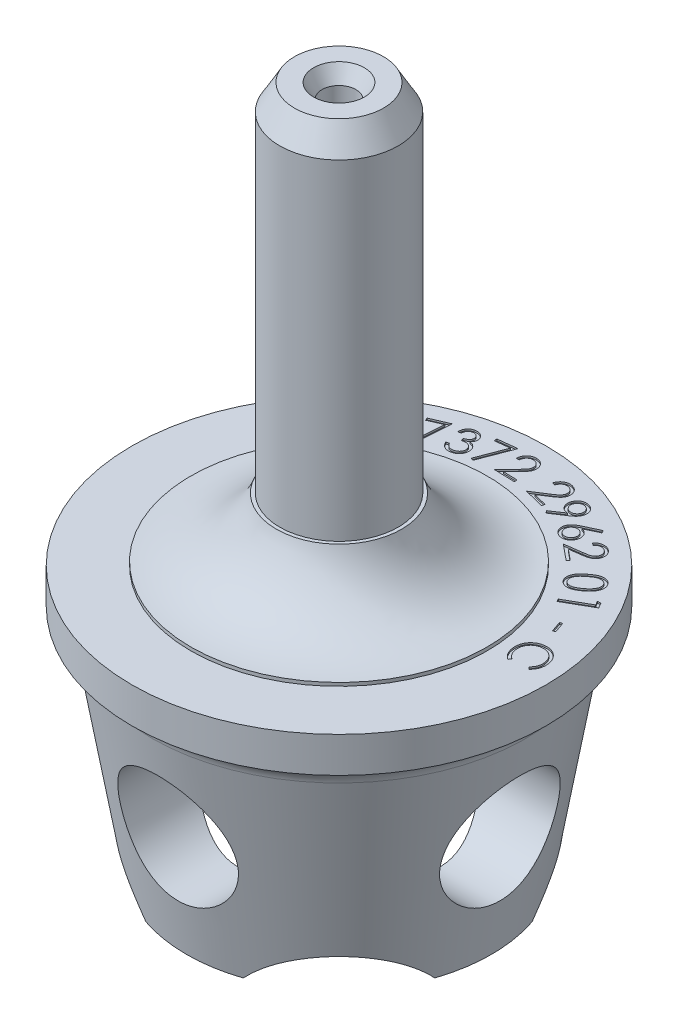
from build123d import *

# Parameters (mm, degrees)
SKETCH2_R          = 3.5
CUT_EXTRUDE1_DEPTH = 44.668194948
CIRPATTERN1_COUNT  = 4
SKETCH3_R          = 5
CUT_EXTRUDE2_DEPTH = 44.668194948
CIRPATTERN2_COUNT  = 4
WRAP3_START        = -0.1
WRAP3_DEPTH        = 0.1


# Read off the part's stored shape, not the designer's step: Wrap3
with BuildPart() as part:
    # Sketch1 → Revolve1 (revolve)
    with BuildSketch(Plane(origin=(0, 0, 0), x_dir=(0, 0, -1), z_dir=(1, 0, 0)), mode=Mode.PRIVATE) as revolve1_sk:
        with BuildLine():
            Line((1.5, 40.1), (2.631474596, 40.1))
            Line((2.631474596, 40.1), (3.4975, 38.6))
            Line((3.4975, 38.6), (3.4975, 19.1))
            Line((3.4975, 19.1), (3.7, 19.1))
            ThreePointArc((3.7, 19.1), (5.659509989, 16.534078699), (8.75, 15.6))
            Line((8.75, 15.6), (8.75, 15.4))
            Line((8.75, 15.4), (12.225, 15.4))
            Line((12.225, 15.4), (12.225, 13.3))
            ThreePointArc((12.225, 13.3), (11.449328772, 12.872543712), (11.05, 12.082024096))
            Line((11.05, 12.082024096), (9, 0))
            Line((9, 0), (7, 0))
            Line((7, 0), (6, 3))
            Line((6, 3), (6, 9.2))
            ThreePointArc((6, 9.2), (5.765685425, 9.765685425), (5.2, 10))
            Line((5.2, 10), (1.5, 10))
            Line((1.5, 10), (1, 10.866025404))
            Line((1, 10.866025404), (1, 13.265164785))
            Line((1, 13.265164785), (0, 13.866025404))
            Line((0, 13.866025404), (0, 36.233974596))
            Line((0, 36.233974596), (1, 36.834835215))
            Line((1, 36.834835215), (1, 39.233974596))
            Line((1, 39.233974596), (1.5, 40.1))
        make_face()
    revolve(revolve1_sk.sketch.rotate(Axis((0, 52.857058389, 0), (0, -1, 0)), 180), axis=Axis((0, 52.857058389, 0), (0, -1, 0)))

    # Sketch2 → Cut-Extrude1 (cut, symmetric)
    with BuildSketch(Plane.XY):
        with Locations(Location((0, 6.5, 0), (0, 0, 50.482347203))):
            Circle(SKETCH2_R)
    cut_extrude1 = extrude(amount=CUT_EXTRUDE1_DEPTH, both=True, mode=Mode.SUBTRACT)

    # CirPattern1: Cut-Extrude1 ×4 about axis
    cirpattern1_axis = Axis((0, 42, 0), (0, -1, 0))
    for i in range(1, CIRPATTERN1_COUNT):
        add(cut_extrude1.rotate(cirpattern1_axis, i * 360 / CIRPATTERN1_COUNT), mode=Mode.SUBTRACT)

    # Sketch3 → Cut-Extrude2 (cut, symmetric)
    with BuildSketch(Plane(origin=(0, 0, 0), x_dir=(0.7071067811865462, 0, 0.7071067811865488), z_dir=(-0.7071067811865488, 0, 0.7071067811865462))):
        with Locations((0, -3)):
            Circle(SKETCH3_R)
    cut_extrude2 = extrude(amount=CUT_EXTRUDE2_DEPTH, both=True, mode=Mode.SUBTRACT)

    # CirPattern2: Cut-Extrude2 ×4 about axis
    cirpattern2_axis = Axis((0, 42, 0), (0, -1, 0))
    for i in range(1, CIRPATTERN2_COUNT):
        add(cut_extrude2.rotate(cirpattern2_axis, i * 360 / CIRPATTERN2_COUNT), mode=Mode.SUBTRACT)

    # Wrap3 outline → Wrap3 (cut)
    # profile 1 of 12: a face of its own
    with BuildSketch(Plane(origin=(0, 15.4, 0), x_dir=(1, 0, 0), z_dir=(0, 1, 0)).offset(WRAP3_START)):
        with BuildLine():
            add(Edge.make_bspline(
                [(-3.326584823, 10.336542313), (-3.326981677, 10.355056697), (-3.327758048, 10.39127662), (-3.324233451, 10.444385593), (-3.318102106, 10.495213365), (-3.307373218, 10.543590824), (-3.2938904, 10.58988524), (-3.276508423, 10.633703424), (-3.255485631, 10.675103162), (-3.230849036, 10.713891087), (-3.203767968, 10.750441524), (-3.17310322, 10.783192329), (-3.140567497, 10.81335966), (-3.105630271, 10.840542234), (-3.067845607, 10.864052059), (-3.027561277, 10.884179382), (-2.984985768, 10.901779348), (-2.95516291, 10.910491633), (-2.940046361, 10.914907698)],
                knots=[0, 0, 0, 0, 0.073357808, 0.143510807, 0.21074725, 0.276054401, 0.339655963, 0.401662468, 0.462589232, 0.523381781, 0.583591151, 0.642582275, 0.700900299, 0.759305798, 0.817724893, 0.876946347, 0.937626821, 1, 1, 1, 1], degree=3))
            Line((-3.326584823, 10.336542313), (-3.150623284, 10.38377789))
            add(Edge.make_bspline(
                [(-2.894974246, 10.747239429), (-2.912758008, 10.741695829), (-2.94752024, 10.730859657), (-2.994854382, 10.704940465), (-3.036820602, 10.673027788), (-3.066158303, 10.640171488), (-3.086349237, 10.610418488), (-3.099920619, 10.585468062), (-3.112359128, 10.558165108), (-3.122991733, 10.528203898), (-3.132496859, 10.495741491), (-3.139729662, 10.460585427), (-3.146534293, 10.423132568), (-3.149234555, 10.397143778), (-3.150623284, 10.38377789)],
                knots=[0, 0, 0, 0, 0.116632374, 0.227983345, 0.336593426, 0.446071954, 0.502548713, 0.56195558, 0.624058588, 0.690617562, 0.761267871, 0.836116505, 0.915715642, 1, 1, 1, 1], degree=3))
            add(Edge.make_bspline(
                [(-2.504469438, 10.555412506), (-2.507308883, 10.564603396), (-2.512897852, 10.582694114), (-2.524065216, 10.608619011), (-2.538326109, 10.632357211), (-2.554669646, 10.654755372), (-2.573853456, 10.675255808), (-2.595620058, 10.694086599), (-2.619923579, 10.711090534), (-2.646449822, 10.72598662), (-2.674428976, 10.739087876), (-2.7036976, 10.749140003), (-2.73375839, 10.756370655), (-2.764539013, 10.760822889), (-2.796078506, 10.761762807), (-2.828397026, 10.759891324), (-2.861592985, 10.75528611), (-2.883714543, 10.749953623), (-2.894974246, 10.747239429)],
                knots=[0, 0, 0, 0, 0.059601419, 0.117315354, 0.17442514, 0.230894843, 0.288877394, 0.348025493, 0.408993958, 0.472381217, 0.536378401, 0.600223651, 0.663825049, 0.727774522, 0.792624523, 0.859030469, 0.928247594, 1, 1, 1, 1], degree=3))
            add(Edge.make_bspline(
                [(-2.828267515, 10.159859621), (-2.809145828, 10.165488607), (-2.771464578, 10.176581101), (-2.718120283, 10.199491967), (-2.668690256, 10.226626634), (-2.623976193, 10.257703071), (-2.584792831, 10.291578748), (-2.552475021, 10.327246828), (-2.52724247, 10.363955228), (-2.510124851, 10.402061864), (-2.499690832, 10.440569181), (-2.494796339, 10.479059003), (-2.496142049, 10.517700151), (-2.501669466, 10.542732236), (-2.504469438, 10.555412506)],
                knots=[0, 0, 0, 0, 0.105059787, 0.207031101, 0.305489388, 0.402037203, 0.493699365, 0.578093251, 0.655281639, 0.727632464, 0.797300594, 0.865002714, 0.931615689, 1, 1, 1, 1], degree=3))
            Line((-2.828267515, 10.159859621), (-2.785719438, 10.001566352))
            add(Edge.make_bspline(
                [(-2.179950207, 9.760700967), (-2.185116258, 9.777115303), (-2.195374002, 9.809707715), (-2.219357431, 9.85530692), (-2.250104571, 9.897092713), (-2.286698217, 9.935078565), (-2.328187516, 9.968121199), (-2.373791374, 9.994845764), (-2.423020047, 10.014503504), (-2.466952387, 10.024836714), (-2.504584203, 10.030220212), (-2.53606269, 10.031911225), (-2.570353221, 10.031247142), (-2.60766663, 10.029621229), (-2.6479703, 10.025537257), (-2.691227348, 10.019264623), (-2.737518615, 10.011324355), (-2.769269292, 10.004896597), (-2.785719438, 10.001566352)],
                knots=[0, 0, 0, 0, 0.070451916, 0.139889784, 0.210077449, 0.282578574, 0.355547238, 0.426889945, 0.498550288, 0.572066162, 0.611377059, 0.654325896, 0.701149386, 0.751972872, 0.807437833, 0.867170545, 0.931180558, 1, 1, 1, 1], degree=3))
            add(Edge.make_bspline(
                [(-2.494012707, 9.273561544), (-2.478903847, 9.277997226), (-2.449246375, 9.28670411), (-2.407197179, 9.303739179), (-2.368077638, 9.323252039), (-2.332384788, 9.345907606), (-2.300012793, 9.371693043), (-2.27103992, 9.400464033), (-2.244846488, 9.431757204), (-2.222748777, 9.466165955), (-2.203820667, 9.501758928), (-2.188473086, 9.538042816), (-2.177167215, 9.57464054), (-2.170059957, 9.611528243), (-2.166254978, 9.648592087), (-2.166737837, 9.685935082), (-2.170885429, 9.723570374), (-2.176911278, 9.748253091), (-2.179950207, 9.760700967)],
                knots=[0, 0, 0, 0, 0.072956248, 0.143207219, 0.209985295, 0.275365767, 0.338799036, 0.401441928, 0.464361718, 0.527567017, 0.590624799, 0.651055634, 0.709919949, 0.76783259, 0.824935526, 0.882325863, 0.940655109, 1, 1, 1, 1], degree=3))
            add(Edge.make_bspline(
                [(-2.791488669, 9.295556736), (-2.780400592, 9.290410918), (-2.758272846, 9.280141745), (-2.723471712, 9.268643687), (-2.687597186, 9.260624358), (-2.650739041, 9.256467102), (-2.612846267, 9.255241988), (-2.574026007, 9.258011361), (-2.5340499, 9.263590058), (-2.507544973, 9.270191258), (-2.494012707, 9.273561544)],
                knots=[0, 0, 0, 0, 0.120091283, 0.239658275, 0.359487699, 0.480839544, 0.603774468, 0.731652338, 0.862993325, 1, 1, 1, 1], degree=3))
            add(Edge.make_bspline(
                [(-2.984036746, 9.503970198), (-2.976585167, 9.491394614), (-2.962198892, 9.467115759), (-2.939239513, 9.432921116), (-2.916102585, 9.401805802), (-2.891657437, 9.374518064), (-2.86765085, 9.349751462), (-2.843008091, 9.328300961), (-2.817824827, 9.310070893), (-2.800125683, 9.300316693), (-2.791488669, 9.295556736)],
                knots=[0, 0, 0, 0, 0.152493168, 0.294408564, 0.429603827, 0.556666854, 0.676387874, 0.789293669, 0.897177306, 1, 1, 1, 1], degree=3))
            Line((-2.984036746, 9.503970198), (-3.152786746, 9.458898083))
            add(Edge.make_bspline(
                [(-2.45146463, 9.105172121), (-2.469791002, 9.100659681), (-2.505703834, 9.091816987), (-2.559768406, 9.08396565), (-2.612481633, 9.080557875), (-2.664113855, 9.082135904), (-2.714485097, 9.087676309), (-2.763623404, 9.098285715), (-2.811425409, 9.113521071), (-2.857968967, 9.133323316), (-2.902812017, 9.157910543), (-2.945411743, 9.187195103), (-2.985709992, 9.221144973), (-3.02403085, 9.259336013), (-3.059758715, 9.302599218), (-3.09329949, 9.350384816), (-3.124732882, 9.402701845), (-3.14330003, 9.43989472), (-3.152786746, 9.458898083)],
                knots=[0, 0, 0, 0, 0.065534887, 0.128423856, 0.189501395, 0.24881655, 0.30765361, 0.365308332, 0.423147221, 0.481702102, 0.540752126, 0.600513844, 0.660978877, 0.723571904, 0.788206735, 0.855628573, 0.926234724, 1, 1, 1, 1], degree=3))
            add(Edge.make_bspline(
                [(-2.013724246, 9.82019616), (-2.008206292, 9.795787552), (-1.997184639, 9.747033393), (-1.993391749, 9.671675422), (-1.99918433, 9.595586966), (-2.012516498, 9.532372676), (-2.02762743, 9.482518646), (-2.041376472, 9.446078744), (-2.057759483, 9.411330043), (-2.075567346, 9.377360002), (-2.096767393, 9.345560997), (-2.119393192, 9.314567751), (-2.144780593, 9.285449527), (-2.181284457, 9.248404262), (-2.231696355, 9.206524297), (-2.298757001, 9.163937894), (-2.372320843, 9.129304891), (-2.424789307, 9.113306044), (-2.45146463, 9.105172121)],
                knots=[0, 0, 0, 0, 0.080290528, 0.160373634, 0.241331161, 0.324956104, 0.367351386, 0.408668593, 0.449967745, 0.490748944, 0.531778121, 0.572641539, 0.613989423, 0.655775128, 0.739693884, 0.823909854, 0.910474571, 1, 1, 1, 1], degree=3))
            add(Edge.make_bspline(
                [(-2.208435784, 10.097119236), (-2.196385166, 10.088052404), (-2.172636116, 10.070183723), (-2.140016059, 10.040418543), (-2.110790009, 10.008618572), (-2.084580479, 9.974942079), (-2.061886307, 9.939141612), (-2.042279983, 9.901414975), (-2.025921826, 9.861716422), (-2.017808799, 9.834099878), (-2.013724246, 9.82019616)],
                knots=[0, 0, 0, 0, 0.130880761, 0.257936462, 0.382748186, 0.505483529, 0.627939064, 0.750225517, 0.874249502, 1, 1, 1, 1], degree=3))
            add(Edge.make_bspline(
                [(-2.451825207, 10.19050866), (-2.429452421, 10.187021725), (-2.38537444, 10.180151904), (-2.322222229, 10.15955921), (-2.262460756, 10.133028039), (-2.226407674, 10.10906462), (-2.208435784, 10.097119236)],
                knots=[0, 0, 0, 0, 0.257610632, 0.507534289, 0.754513658, 1, 1, 1, 1], degree=3))
            add(Edge.make_bspline(
                [(-2.32490213, 10.602287506), (-2.320620317, 10.583987984), (-2.312216849, 10.548073425), (-2.309283084, 10.493330868), (-2.313534612, 10.439817275), (-2.325515805, 10.387273156), (-2.345853855, 10.33599058), (-2.37343434, 10.285724233), (-2.408827883, 10.236459013), (-2.437157693, 10.20618353), (-2.451825207, 10.19050866)],
                knots=[0, 0, 0, 0, 0.124283765, 0.243918757, 0.361339877, 0.478955161, 0.599448008, 0.725571952, 0.857917249, 1, 1, 1, 1], degree=3))
            add(Edge.make_bspline(
                [(-2.940046361, 10.914907698), (-2.917673528, 10.920213195), (-2.873445501, 10.930701436), (-2.805732795, 10.935534123), (-2.738407195, 10.9333636), (-2.672201865, 10.922001787), (-2.608636574, 10.9034541), (-2.549099149, 10.877881525), (-2.495070232, 10.84440639), (-2.446738566, 10.804285552), (-2.404908069, 10.759129904), (-2.369661882, 10.710467769), (-2.342417522, 10.658070005), (-2.330740817, 10.620882381), (-2.32490213, 10.602287506)],
                knots=[0, 0, 0, 0, 0.090006377, 0.177930281, 0.265160858, 0.353544378, 0.44046773, 0.524239674, 0.60674991, 0.68873649, 0.769753327, 0.847422227, 0.923706748, 1, 1, 1, 1], degree=3))
        make_face()
    # profile 2 of 12: a face of its own
    with BuildSketch(Plane(origin=(0, 15.4, 0), x_dir=(1, 0, 0), z_dir=(0, 1, 0)).offset(WRAP3_START)):
        with BuildLine():
            add(Edge.make_bspline(
                [(8.891250508, 6.988660551), (8.899816109, 6.977109), (8.916746212, 6.954277103), (8.939314287, 6.918388866), (8.958431342, 6.881206012), (8.974274443, 6.842792272), (8.987379954, 6.803440105), (8.997185224, 6.76279621), (9.003496162, 6.72103944), (9.007174544, 6.678287592), (9.007736782, 6.634733661), (9.003789569, 6.590647723), (8.997153532, 6.545972035), (8.986031448, 6.501012123), (8.97203132, 6.455426578), (8.954251022, 6.409375916), (8.932442456, 6.363077368), (8.907528319, 6.315817389), (8.878289973, 6.268057647), (8.843750538, 6.220026238), (8.804299291, 6.171458943), (8.76021389, 6.121820868), (8.710788743, 6.071972301), (8.656490693, 6.021393785), (8.597339211, 5.970125301), (8.555435492, 5.936708717), (8.533918777, 5.919549974)],
                knots=[0, 0, 0, 0, 0.034096833, 0.067393149, 0.100411342, 0.133125464, 0.165845794, 0.198685099, 0.232145721, 0.265901284, 0.300392588, 0.335284381, 0.37076042, 0.407402501, 0.44499893, 0.483800305, 0.524353529, 0.566305141, 0.610449912, 0.657038428, 0.706496357, 0.758786678, 0.814417425, 0.872903227, 0.93473837, 1, 1, 1, 1], degree=3))
            add(Edge.make_bspline(
                [(7.779952431, 6.881208628), (7.802658385, 6.898811316), (7.846689607, 6.932946321), (7.912943284, 6.979775108), (7.976392263, 7.022037162), (8.037108703, 7.059791019), (8.095762851, 7.091842342), (8.151643195, 7.119585435), (8.205256311, 7.141962705), (8.256743845, 7.159504149), (8.306269132, 7.172897367), (8.354573859, 7.182730988), (8.401786034, 7.189216743), (8.447922526, 7.192645292), (8.492888175, 7.192209957), (8.536760203, 7.188620821), (8.579569133, 7.181821171), (8.621197071, 7.171756407), (8.661111308, 7.158291444), (8.699625049, 7.142428896), (8.736274116, 7.123726971), (8.771168205, 7.102337279), (8.804107384, 7.078097123), (8.835044045, 7.050915109), (8.864578373, 7.021354681), (8.882295537, 6.999637362), (8.891250508, 6.988660551)],
                knots=[0, 0, 0, 0, 0.068628769, 0.133084417, 0.193768777, 0.250747723, 0.303821968, 0.353390781, 0.399730702, 0.442499084, 0.483246612, 0.522215171, 0.560183888, 0.597028499, 0.632634968, 0.667497312, 0.702099719, 0.736085455, 0.769682016, 0.802636838, 0.835511502, 0.86786667, 0.900314717, 0.933080102, 0.966175978, 1, 1, 1, 1], degree=3))
            add(Edge.make_bspline(
                [(7.411442815, 5.828324013), (7.402979712, 5.839623471), (7.38619621, 5.862031855), (7.364205874, 5.897458384), (7.345333323, 5.933968428), (7.329842263, 5.971667617), (7.317186907, 6.010354789), (7.307401397, 6.049985253), (7.300846638, 6.09074508), (7.297707754, 6.132466665), (7.297570938, 6.175039409), (7.301411121, 6.218046895), (7.308030779, 6.261537182), (7.319207088, 6.305159902), (7.333156323, 6.349331622), (7.3510712, 6.393645484), (7.371913881, 6.438604851), (7.397042022, 6.483859827), (7.426522347, 6.530073773), (7.461097746, 6.577260368), (7.501555658, 6.625107029), (7.546443359, 6.674640041), (7.597341193, 6.724683751), (7.653169572, 6.776254115), (7.714482818, 6.828817616), (7.757732741, 6.863427677), (7.779952431, 6.881208628)],
                knots=[0, 0, 0, 0, 0.033748241, 0.066927417, 0.099579509, 0.131926553, 0.164285087, 0.19684089, 0.229446139, 0.262888214, 0.296804946, 0.331129665, 0.366050924, 0.401882959, 0.438697562, 0.476753546, 0.516101014, 0.557140131, 0.600436278, 0.647117766, 0.696910388, 0.750216051, 0.806921395, 0.867537091, 0.931947055, 1, 1, 1, 1], degree=3))
            add(Edge.make_bspline(
                [(8.533918777, 5.919549974), (8.512276911, 5.902813443), (8.470108944, 5.870203245), (8.406543149, 5.824999373), (8.344622073, 5.784735867), (8.284731319, 5.748758781), (8.226514163, 5.717797445), (8.170351377, 5.690658945), (8.115462786, 5.669276615), (8.062595476, 5.651555781), (8.011026334, 5.638717815), (7.960964165, 5.62892592), (7.912215339, 5.622230743), (7.864611302, 5.619431071), (7.818206803, 5.619593607), (7.773008852, 5.623651222), (7.729131533, 5.630864908), (7.686557938, 5.641298662), (7.645551649, 5.65492361), (7.606489236, 5.671697197), (7.569113993, 5.690744251), (7.533791563, 5.712888437), (7.500047977, 5.737445384), (7.46826546, 5.764874706), (7.438605292, 5.795276241), (7.420543224, 5.817251818), (7.411442815, 5.828324013)],
                knots=[0, 0, 0, 0, 0.064930891, 0.126514217, 0.185067459, 0.240205524, 0.29227683, 0.34153305, 0.388151054, 0.43199458, 0.473785351, 0.514179895, 0.553033004, 0.590473806, 0.62727554, 0.663072871, 0.698059643, 0.732723928, 0.767004584, 0.800492655, 0.833537934, 0.866468495, 0.899334738, 0.93250538, 0.965993451, 1, 1, 1, 1], degree=3))
        make_face()
        with BuildLine():
            add(Edge.make_bspline(
                [(7.542692815, 5.92351632), (7.555561842, 5.908734771), (7.581290173, 5.879182839), (7.62869393, 5.843224753), (7.682611089, 5.815412996), (7.731784138, 5.798263931), (7.773815198, 5.789204359), (7.806894046, 5.785367676), (7.84077074, 5.783795038), (7.87559522, 5.785461537), (7.91141197, 5.789307981), (7.948200111, 5.796422831), (7.986114247, 5.805558272), (8.01125751, 5.813952611), (8.024063008, 5.818227859)],
                knots=[0, 0, 0, 0, 0.111270375, 0.222456684, 0.33592389, 0.455286661, 0.517512646, 0.580187813, 0.644519489, 0.710217475, 0.778326361, 0.849269627, 0.92323282, 1, 1, 1, 1], degree=3))
            add(Edge.make_bspline(
                [(7.881274546, 6.745631705), (7.862065319, 6.730489043), (7.824774237, 6.701092428), (7.772323911, 6.656475032), (7.724649048, 6.613358378), (7.681070274, 6.572410904), (7.642506928, 6.532402164), (7.608617931, 6.49386774), (7.57911137, 6.457103725), (7.554356162, 6.421332115), (7.533194458, 6.386568622), (7.515593057, 6.35207292), (7.500204189, 6.318143828), (7.48786832, 6.284154341), (7.478589161, 6.25011228), (7.471456678, 6.2163202), (7.468065816, 6.182608116), (7.4665108, 6.13895738), (7.470974251, 6.086302987), (7.485453572, 6.026676967), (7.508717824, 5.971578959), (7.531389718, 5.939506219), (7.542692815, 5.92351632)],
                knots=[0, 0, 0, 0, 0.073813239, 0.143294445, 0.207759163, 0.267797027, 0.323720771, 0.375382526, 0.422627823, 0.465894504, 0.506578347, 0.545351289, 0.582696471, 0.618954807, 0.654331528, 0.689117548, 0.723045751, 0.756434508, 0.820867583, 0.881746563, 0.941044626, 1, 1, 1, 1], degree=3))
            add(Edge.make_bspline(
                [(8.761082238, 6.87868459), (8.748269187, 6.893656542), (8.722695218, 6.923539529), (8.674370199, 6.958885298), (8.620190589, 6.987525891), (8.570004706, 7.00356117), (8.527711034, 7.013403284), (8.49437582, 7.017668111), (8.46012553, 7.018995323), (8.425064809, 7.017888815), (8.389139037, 7.014298336), (8.352274278, 7.007726717), (8.314511756, 6.998251767), (8.275474628, 6.98621388), (8.234717523, 6.971086946), (8.191948957, 6.951100591), (8.146312243, 6.927557484), (8.098387831, 6.898985496), (8.047497873, 6.867163215), (7.994432594, 6.830242615), (7.938338841, 6.789863166), (7.900656465, 6.760654945), (7.881274546, 6.745631705)],
                knots=[0, 0, 0, 0, 0.059241393, 0.118241747, 0.179192209, 0.243370321, 0.276429089, 0.31005314, 0.344512495, 0.379682971, 0.415744027, 0.453280917, 0.492483113, 0.533063207, 0.576413134, 0.62344259, 0.675312667, 0.731190673, 0.791618493, 0.856255426, 0.926065022, 1, 1, 1, 1], degree=3))
            add(Edge.make_bspline(
                [(8.427188008, 6.049357667), (8.444487164, 6.063044533), (8.478228417, 6.089740171), (8.52584645, 6.131157563), (8.570296754, 6.171713843), (8.610951684, 6.212125919), (8.648331499, 6.251752613), (8.681861214, 6.291227403), (8.712356117, 6.329916459), (8.738599218, 6.368698367), (8.761824103, 6.406720967), (8.782064762, 6.443919116), (8.79874075, 6.480737901), (8.812602887, 6.516674622), (8.822961461, 6.552172512), (8.830931725, 6.586910399), (8.834668943, 6.621139842), (8.836167369, 6.664930843), (8.831630242, 6.717296393), (8.817612783, 6.776580232), (8.794786628, 6.831269743), (8.772273954, 6.862940247), (8.761082238, 6.87868459)],
                knots=[0, 0, 0, 0, 0.06655196, 0.129806704, 0.190382626, 0.248083887, 0.302736698, 0.354701344, 0.404322447, 0.451299265, 0.495896071, 0.538734322, 0.578984329, 0.617781711, 0.654847028, 0.690486775, 0.725170769, 0.758554287, 0.822615883, 0.883047238, 0.941859326, 1, 1, 1, 1], degree=3))
            add(Edge.make_bspline(
                [(8.024063008, 5.818227859), (8.040232049, 5.824074955), (8.073011875, 5.835928891), (8.121842134, 5.857075377), (8.171299463, 5.881251305), (8.221322617, 5.908810704), (8.272246817, 5.938970268), (8.323476611, 5.972734466), (8.375488696, 6.00946061), (8.409734804, 6.035888794), (8.427188008, 6.049357667)],
                knots=[0, 0, 0, 0, 0.110475976, 0.223970198, 0.341769759, 0.464137909, 0.590912467, 0.72202727, 0.858333842, 1, 1, 1, 1], degree=3))
        make_face(mode=Mode.SUBTRACT)
    # profile 3 of 12: a face of its own
    with BuildSketch(Plane(origin=(0, 15.4, 0), x_dir=(1, 0, 0), z_dir=(0, 1, 0)).offset(WRAP3_START)):
        with BuildLine():
            add(Edge.make_bspline(
                [(6.338874923, 8.634579887), (6.353421738, 8.650435291), (6.382009477, 8.681594696), (6.428236261, 8.723628507), (6.476839112, 8.759866666), (6.527342635, 8.79073118), (6.58014709, 8.815652321), (6.634706206, 8.835790083), (6.691585593, 8.849712808), (6.74977869, 8.858278366), (6.808205729, 8.861634578), (6.865834482, 8.859138905), (6.922046948, 8.850865552), (6.976715527, 8.836612566), (7.030071026, 8.817126912), (7.081829171, 8.791628722), (7.132199541, 8.760589681), (7.163730477, 8.736084759), (7.179740307, 8.723642387)],
                knots=[0, 0, 0, 0, 0.06850539, 0.134628377, 0.198629938, 0.261323496, 0.322790925, 0.384306009, 0.446229427, 0.508917142, 0.571405866, 0.632327375, 0.692308441, 0.752005467, 0.811951101, 0.872895454, 0.93546268, 1, 1, 1, 1], degree=3))
            Line((6.338874923, 8.634579887), (6.470846076, 8.52640681))
            add(Edge.make_bspline(
                [(7.064355692, 8.599243349), (7.053332153, 8.607873065), (7.031717867, 8.62479369), (6.997229813, 8.646061148), (6.962058287, 8.663657459), (6.925726109, 8.676967923), (6.888682794, 8.686769933), (6.850734438, 8.692620953), (6.811941751, 8.694367212), (6.772443515, 8.692187668), (6.732823941, 8.686063342), (6.693509135, 8.67594058), (6.654951333, 8.661333951), (6.616637155, 8.64291254), (6.579388516, 8.619469794), (6.5419983, 8.592864422), (6.50544711, 8.561730155), (6.482566201, 8.538371598), (6.470846076, 8.52640681)],
                knots=[0, 0, 0, 0, 0.063027949, 0.123581382, 0.182183543, 0.239918745, 0.29757518, 0.354551264, 0.412552464, 0.47220341, 0.532472924, 0.592885777, 0.654739831, 0.717946623, 0.784068855, 0.852742499, 0.924571342, 1, 1, 1, 1], degree=3))
            add(Edge.make_bspline(
                [(7.130341269, 8.07063758), (7.137904681, 8.080332952), (7.152867526, 8.099513494), (7.171069139, 8.130829943), (7.186406388, 8.162942661), (7.198116793, 8.196268305), (7.205573463, 8.230938048), (7.209841183, 8.26666416), (7.211109391, 8.303739996), (7.20798129, 8.341502339), (7.201984116, 8.379155171), (7.192734778, 8.415717286), (7.179625812, 8.450460916), (7.163244197, 8.483506176), (7.143699057, 8.515124121), (7.120529658, 8.54499485), (7.094074147, 8.573355543), (7.07437132, 8.590518715), (7.064355692, 8.599243349)],
                knots=[0, 0, 0, 0, 0.062220212, 0.123091446, 0.183005275, 0.242306627, 0.301539189, 0.362251904, 0.424376731, 0.489093449, 0.553850244, 0.617344119, 0.679763569, 0.741568386, 0.803907623, 0.86771594, 0.932755437, 1, 1, 1, 1], degree=3))
            add(Edge.make_bspline(
                [(6.522048, 7.852849118), (6.546094652, 7.856157895), (6.592420505, 7.86253225), (6.658895257, 7.872603302), (6.719653295, 7.882534715), (6.774545923, 7.893121268), (6.82376926, 7.903353195), (6.867265678, 7.913926513), (6.905072491, 7.924001742), (6.947193145, 7.938419185), (6.994365797, 7.958862856), (7.045103669, 7.990028902), (7.091382646, 8.026734832), (7.117282825, 8.055921927), (7.130341269, 8.07063758)],
                knots=[0, 0, 0, 0, 0.109926885, 0.211774031, 0.304482179, 0.388712107, 0.464937173, 0.532136627, 0.591430687, 0.642038362, 0.733672845, 0.823572353, 0.911048085, 1, 1, 1, 1], degree=3))
            Line((6.522048, 7.852849118), (5.530100884, 7.716911618))
            Line((5.530100884, 7.716911618), (6.464355692, 6.949603926))
            Line((6.464355692, 6.949603926), (6.573249923, 7.082296234))
            Line((6.573249923, 7.082296234), (5.938273961, 7.603690464))
            Line((5.938273961, 7.603690464), (6.584427807, 7.69203181))
            add(Edge.make_bspline(
                [(7.266278769, 7.963546234), (7.249773787, 7.944959575), (7.216994553, 7.908046089), (7.160197409, 7.860626334), (7.097796753, 7.821032915), (7.041185312, 7.793922865), (6.991057323, 7.776002057), (6.948320364, 7.762256001), (6.90028749, 7.749370268), (6.84703577, 7.73733565), (6.788810172, 7.724909331), (6.725265051, 7.713605327), (6.656641807, 7.702329483), (6.609081059, 7.695547349), (6.584427807, 7.69203181)],
                knots=[0, 0, 0, 0, 0.09891559, 0.196448395, 0.293539508, 0.392695826, 0.445709463, 0.505519524, 0.571489704, 0.643729447, 0.7229828, 0.808630826, 0.900803233, 1, 1, 1, 1], degree=3))
            add(Edge.make_bspline(
                [(7.179740307, 8.723642387), (7.19488875, 8.710563366), (7.224525885, 8.684974943), (7.264044488, 8.642845738), (7.298083179, 8.598760764), (7.326816595, 8.552775294), (7.350012123, 8.504744422), (7.368329323, 8.45483087), (7.380461345, 8.402619028), (7.387172955, 8.349199922), (7.388896747, 8.295737243), (7.386205404, 8.243202231), (7.378182402, 8.192253604), (7.365545618, 8.142976006), (7.348153945, 8.095319391), (7.32563033, 8.049514048), (7.298531141, 8.005137005), (7.277127604, 7.977536257), (7.266278769, 7.963546234)],
                knots=[0, 0, 0, 0, 0.070235512, 0.137412107, 0.202409769, 0.265530698, 0.327440801, 0.389385416, 0.451828322, 0.515219554, 0.578136994, 0.639423997, 0.6996498, 0.758915696, 0.817795668, 0.87743902, 0.937877374, 1, 1, 1, 1], degree=3))
        make_face()
    # profile 4 of 12: a face of its own
    with BuildSketch(Plane(origin=(0, 15.4, 0), x_dir=(1, 0, 0), z_dir=(0, 1, 0)).offset(WRAP3_START)):
        with BuildLine():
            add(Edge.make_bspline(
                [(4.064486289, 9.419323203), (4.047861844, 9.420977871), (4.015395854, 9.424209284), (3.968555726, 9.433425182), (3.924472204, 9.44512653), (3.896741364, 9.455629179), (3.883116097, 9.46078955)],
                knots=[0, 0, 0, 0, 0.26825893, 0.523884648, 0.766065551, 1, 1, 1, 1], degree=3))
            Line((4.064486289, 9.419323203), (3.333236289, 8.928217434))
            Line((3.333236289, 8.928217434), (3.432394943, 8.783265511))
            Line((3.432394943, 8.783265511), (4.248741097, 9.322688588))
            add(Edge.make_bspline(
                [(4.639606482, 9.72797705), (4.631905256, 9.710848605), (4.616259679, 9.676050974), (4.585739959, 9.626375807), (4.550253737, 9.577266876), (4.515753677, 9.53772876), (4.484981117, 9.505915026), (4.458976347, 9.481388218), (4.430205366, 9.45657309), (4.39938574, 9.430453987), (4.365447591, 9.404297437), (4.328910098, 9.377642505), (4.289931261, 9.350099544), (4.262728819, 9.331997044), (4.248741097, 9.322688588)],
                knots=[0, 0, 0, 0, 0.098473041, 0.200054855, 0.305284568, 0.41619367, 0.475077813, 0.537549008, 0.603713565, 0.674464129, 0.749539567, 0.828520282, 0.911823701, 1, 1, 1, 1], degree=3))
            add(Edge.make_bspline(
                [(4.348260328, 10.44624628), (4.370437816, 10.435992259), (4.414215564, 10.415751105), (4.474311625, 10.375690098), (4.52841035, 10.328685978), (4.575567248, 10.274376694), (4.615506179, 10.214876855), (4.647115193, 10.15072272), (4.668711707, 10.082241098), (4.681095803, 10.010812649), (4.684780728, 9.938246532), (4.679245782, 9.866330318), (4.665219972, 9.795549926), (4.648187772, 9.750615997), (4.639606482, 9.72797705)],
                knots=[0, 0, 0, 0, 0.084857229, 0.167505824, 0.250149136, 0.333382148, 0.416841502, 0.498710787, 0.581188016, 0.665634621, 0.750161857, 0.833151073, 0.915936929, 1, 1, 1, 1], degree=3))
            add(Edge.make_bspline(
                [(3.617731482, 10.152015511), (3.628149375, 10.17507657), (3.648615505, 10.220380413), (3.689887507, 10.281551341), (3.736836519, 10.336362945), (3.790971789, 10.383290236), (3.85050675, 10.422771246), (3.915166255, 10.453721197), (3.984562304, 10.475278375), (4.05731205, 10.488609695), (4.131735937, 10.492547133), (4.205712542, 10.487000571), (4.278573002, 10.472642608), (4.324907337, 10.455091981), (4.348260328, 10.44624628)],
                knots=[0, 0, 0, 0, 0.0863877, 0.169710108, 0.251286144, 0.332552056, 0.413823164, 0.494889309, 0.576775324, 0.661577523, 0.747179597, 0.830834791, 0.914738962, 1, 1, 1, 1], degree=3))
            add(Edge.make_bspline(
                [(3.883116097, 9.46078955), (3.8670705, 9.467888394), (3.835476649, 9.48186605), (3.791741023, 9.508679148), (3.751456757, 9.538511727), (3.715190076, 9.572371499), (3.682551863, 9.609692779), (3.653641311, 9.650695409), (3.628147475, 9.695263825), (3.607345773, 9.743271143), (3.590236445, 9.792976694), (3.578771467, 9.843655886), (3.572169904, 9.89460058), (3.570644953, 9.945832769), (3.574737343, 9.997291881), (3.583968012, 10.048909151), (3.597823024, 10.100903849), (3.611033402, 10.134819303), (3.617731482, 10.152015511)],
                knots=[0, 0, 0, 0, 0.063731665, 0.125487922, 0.186057649, 0.245736398, 0.305511073, 0.366016129, 0.427863546, 0.491847922, 0.55597094, 0.618730282, 0.680415372, 0.742495488, 0.804736901, 0.867746793, 0.932943438, 1, 1, 1, 1], degree=3))
        make_face()
        with BuildLine():
            add(Edge.make_bspline(
                [(4.477346866, 9.792159742), (4.482060161, 9.804090246), (4.491340842, 9.827581924), (4.50050872, 9.863934903), (4.506530322, 9.900115106), (4.508222367, 9.936398116), (4.506373616, 9.972735777), (4.5010948, 10.009154288), (4.491459129, 10.045429817), (4.478556004, 10.081263277), (4.46259218, 10.115826116), (4.443634826, 10.14830659), (4.422088329, 10.178194613), (4.397835978, 10.205432875), (4.370737205, 10.229777351), (4.341216647, 10.251903587), (4.3085844, 10.27104912), (4.285381608, 10.281549166), (4.273620905, 10.28687128)],
                knots=[0, 0, 0, 0, 0.064621318, 0.127242169, 0.18861889, 0.249300469, 0.309982048, 0.371865358, 0.434486209, 0.498899728, 0.563705512, 0.626176612, 0.688246609, 0.749196952, 0.809696667, 0.871636339, 0.934936841, 1, 1, 1, 1], degree=3))
            add(Edge.make_bspline(
                [(3.981914174, 9.590236665), (3.993978931, 9.585576013), (4.017661693, 9.576427292), (4.054095379, 9.566511668), (4.090618056, 9.560861674), (4.127094024, 9.558515967), (4.163469227, 9.560456204), (4.199789295, 9.565970023), (4.236224883, 9.574853883), (4.27208819, 9.587989307), (4.306665681, 9.603898035), (4.339140083, 9.622871298), (4.36903804, 9.644407588), (4.396243212, 9.66868468), (4.420661939, 9.695641759), (4.442225198, 9.725353098), (4.461559029, 9.757522639), (4.472036595, 9.780509482), (4.477346866, 9.792159742)],
                knots=[0, 0, 0, 0, 0.065165857, 0.127918649, 0.189870885, 0.251167965, 0.311827017, 0.373088159, 0.436123984, 0.500513591, 0.565295319, 0.627743228, 0.689790183, 0.7507179, 0.811195157, 0.872752154, 0.935507871, 1, 1, 1, 1], degree=3))
            add(Edge.make_bspline(
                [(3.779991097, 10.08422705), (3.775280834, 10.072296343), (3.766006123, 10.048804265), (3.756794818, 10.012454192), (3.750932345, 9.976256746), (3.7486436, 9.93988643), (3.750549575, 9.903512672), (3.756086236, 9.867073065), (3.764967742, 9.830636811), (3.778107751, 9.794777008), (3.794000599, 9.760186213), (3.812945665, 9.727904648), (3.834106933, 9.698030125), (3.858698416, 9.671357131), (3.885243825, 9.646515367), (3.915140193, 9.625042115), (3.947189809, 9.605606117), (3.970249985, 9.595399386), (3.981914174, 9.590236665)],
                knots=[0, 0, 0, 0, 0.064757221, 0.127509768, 0.189015568, 0.249858117, 0.311273896, 0.372686672, 0.435878524, 0.500427508, 0.565369584, 0.627972064, 0.689324749, 0.7499517, 0.810987938, 0.872697302, 0.935608351, 1, 1, 1, 1], degree=3))
            add(Edge.make_bspline(
                [(4.273620905, 10.28687128), (4.261690401, 10.291584575), (4.238198722, 10.300865256), (4.201845745, 10.310033133), (4.165665536, 10.31605474), (4.129382544, 10.317746765), (4.093044816, 10.315898091), (4.05662656, 10.31061898), (4.020350057, 10.300984441), (3.984520351, 10.288076953), (3.949943507, 10.272129403), (3.917658341, 10.253198454), (3.88778475, 10.232033532), (3.861111511, 10.207443011), (3.836269813, 10.180897343), (3.814796543, 10.151001045), (3.79536055, 10.11895141), (3.785153818, 10.095891237), (3.779991097, 10.08422705)],
                knots=[0, 0, 0, 0, 0.064788226, 0.127570818, 0.189106067, 0.249944378, 0.310782689, 0.372825836, 0.435608428, 0.500188318, 0.565161487, 0.627793941, 0.689176001, 0.749831979, 0.810897441, 0.87263635, 0.935577521, 1, 1, 1, 1], degree=3))
        make_face(mode=Mode.SUBTRACT)
    # profile 5 of 12: a face of its own
    with BuildSketch(Plane(origin=(0, 15.4, 0), x_dir=(1, 0, 0), z_dir=(0, 1, 0)).offset(WRAP3_START)):
        with BuildLine():
            add(Edge.make_bspline(
                [(5.306153196, 9.043725446), (5.32257253, 9.039904805), (5.354547991, 9.032464382), (5.400100574, 9.017156314), (5.442177996, 8.999344055), (5.468049436, 8.984824256), (5.480672427, 8.97773987)],
                knots=[0, 0, 0, 0, 0.269757851, 0.525333814, 0.768404581, 1, 1, 1, 1], degree=3))
            Line((5.306153196, 9.043725446), (6.101585888, 9.424494677))
            Line((6.101585888, 9.424494677), (6.024783003, 9.5835091))
            Line((6.024783003, 9.5835091), (5.137763773, 9.166682177))
            add(Edge.make_bspline(
                [(4.692451273, 8.821970639), (4.702626279, 8.837674748), (4.723259609, 8.869520238), (4.760119779, 8.914449995), (4.802645051, 8.957309668), (4.851043833, 8.99962716), (4.907968864, 9.041228216), (4.975062666, 9.082634915), (5.05221283, 9.125799531), (5.108268707, 9.152587226), (5.137763773, 9.166682177)],
                knots=[0, 0, 0, 0, 0.098166559, 0.199066515, 0.30435449, 0.41480668, 0.53619873, 0.673963716, 0.828448646, 1, 1, 1, 1], degree=3))
            add(Edge.make_bspline(
                [(4.876345503, 8.0694466), (4.855992523, 8.082609587), (4.815671393, 8.108686677), (4.762544219, 8.157073481), (4.715833749, 8.211187678), (4.676678246, 8.2713393), (4.645576492, 8.335980731), (4.624151103, 8.404129241), (4.612163947, 8.474853362), (4.609797691, 8.547348561), (4.616528334, 8.619833738), (4.632615844, 8.690445824), (4.657321965, 8.758506373), (4.680695, 8.800731871), (4.692451273, 8.821970639)],
                knots=[0, 0, 0, 0, 0.084181989, 0.166772282, 0.248887244, 0.332253604, 0.41564721, 0.497618396, 0.579882194, 0.664376028, 0.749191895, 0.83235047, 0.915674895, 1, 1, 1, 1], degree=3))
            add(Edge.make_bspline(
                [(5.644013773, 8.254783139), (5.630280793, 8.233446779), (5.603352429, 8.191609301), (5.553586635, 8.136707865), (5.4988316, 8.08912433), (5.438291939, 8.050080002), (5.373418469, 8.019634135), (5.304928424, 7.998079438), (5.233023361, 7.986741644), (5.159162695, 7.98429469), (5.084773244, 7.990822142), (5.012388584, 8.007918899), (4.941923547, 8.032823777), (4.898394441, 8.057133114), (4.876345503, 8.0694466)],
                knots=[0, 0, 0, 0, 0.086339158, 0.16929845, 0.251484725, 0.332941115, 0.413926595, 0.495020751, 0.576764952, 0.661186489, 0.7463253, 0.830379419, 0.914081545, 1, 1, 1, 1], degree=3))
            add(Edge.make_bspline(
                [(5.480672427, 8.97773987), (5.49540172, 8.968269888), (5.5244442, 8.949597454), (5.564289222, 8.917318239), (5.599879025, 8.881838504), (5.630981188, 8.843079572), (5.657861757, 8.801230532), (5.680614463, 8.756429674), (5.69911057, 8.708473294), (5.712910443, 8.658073006), (5.722322013, 8.606434595), (5.726700774, 8.554631019), (5.72599244, 8.50330052), (5.720218597, 8.45229959), (5.709029278, 8.401918187), (5.692407529, 8.352067161), (5.671433894, 8.302439685), (5.653249539, 8.270835026), (5.644013773, 8.254783139)],
                knots=[0, 0, 0, 0, 0.063582499, 0.125368781, 0.185887573, 0.245831785, 0.305546531, 0.366280764, 0.428073217, 0.491954902, 0.555851509, 0.618514192, 0.680526886, 0.74205804, 0.804672018, 0.867639771, 0.932774736, 1, 1, 1, 1], degree=3))
        make_face()
        with BuildLine():
            add(Edge.make_bspline(
                [(4.84389358, 8.73398987), (4.837511157, 8.722818073), (4.824977049, 8.700878366), (4.81070549, 8.666131241), (4.799294482, 8.631263153), (4.791964082, 8.595577328), (4.788981482, 8.559300121), (4.788723693, 8.522466739), (4.792904408, 8.485158323), (4.800490816, 8.44790836), (4.811056412, 8.411357696), (4.825261441, 8.376655026), (4.842193872, 8.343927781), (4.862416231, 8.313596338), (4.885839793, 8.285654085), (4.911717117, 8.259620995), (4.940819478, 8.235876459), (4.962134552, 8.222358488), (4.972980119, 8.215480254)],
                knots=[0, 0, 0, 0, 0.064885346, 0.127424937, 0.189209496, 0.249893944, 0.310811487, 0.372697248, 0.435545099, 0.499917825, 0.564424794, 0.627293142, 0.688895713, 0.750147713, 0.810895821, 0.872674421, 0.935214012, 1, 1, 1, 1], degree=3))
            add(Edge.make_bspline(
                [(5.362763773, 8.864158139), (5.351591976, 8.870540562), (5.32965227, 8.88307467), (5.294905143, 8.897346232), (5.260037063, 8.908757225), (5.224351206, 8.916087683), (5.188074118, 8.919070066), (5.151240282, 8.91932868), (5.113933605, 8.915144805), (5.076676975, 8.907570513), (5.040151152, 8.896959775), (5.005306491, 8.882896987), (4.972918654, 8.865367796), (4.942113702, 8.845610113), (4.914211952, 8.822049099), (4.888306528, 8.795714694), (4.864251753, 8.766624539), (4.850746086, 8.744974611), (4.84389358, 8.73398987)],
                knots=[0, 0, 0, 0, 0.064772915, 0.127204139, 0.188881639, 0.249460935, 0.310272922, 0.37205145, 0.434790399, 0.499051582, 0.563446776, 0.626206187, 0.687984715, 0.748796701, 0.810292529, 0.871537304, 0.934820592, 1, 1, 1, 1], degree=3))
            add(Edge.make_bspline(
                [(5.491489734, 8.34492737), (5.497833255, 8.356113669), (5.510368732, 8.378218992), (5.525265644, 8.412989163), (5.535836716, 8.44851144), (5.54390796, 8.484245226), (5.546716199, 8.520587768), (5.547028552, 8.557290347), (5.542794331, 8.594592573), (5.535309413, 8.631981411), (5.524681702, 8.668640532), (5.510482715, 8.703342897), (5.493554439, 8.736075979), (5.473309875, 8.766384653), (5.450025033, 8.794346731), (5.423896062, 8.820005766), (5.39494146, 8.843779083), (5.373615088, 8.857285688), (5.362763773, 8.864158139)],
                knots=[0, 0, 0, 0, 0.064790004, 0.128031979, 0.190123072, 0.25143491, 0.312262941, 0.373451936, 0.436207438, 0.501079532, 0.565491716, 0.628267685, 0.689779737, 0.750941734, 0.81160058, 0.872861513, 0.935309208, 1, 1, 1, 1], degree=3))
            add(Edge.make_bspline(
                [(4.972980119, 8.215480254), (4.984155242, 8.209107582), (5.006101482, 8.196592624), (5.04076778, 8.182195831), (5.075775553, 8.171306153), (5.111406242, 8.164042428), (5.147649771, 8.160314447), (5.184504726, 8.160839268), (5.221811094, 8.164805019), (5.259061784, 8.172450731), (5.295612252, 8.18300036), (5.330314973, 8.197209548), (5.363042204, 8.214140896), (5.393373651, 8.234363541), (5.421315903, 8.257787027), (5.447348993, 8.283664372), (5.47109353, 8.312766727), (5.4846115, 8.334081802), (5.491489734, 8.34492737)],
                knots=[0, 0, 0, 0, 0.06489324, 0.127440439, 0.189050503, 0.249742334, 0.310724674, 0.372620938, 0.435476434, 0.49985699, 0.564371807, 0.627247803, 0.688857867, 0.750117319, 0.810872817, 0.872658932, 0.935206131, 1, 1, 1, 1], degree=3))
        make_face(mode=Mode.SUBTRACT)
    # profile 6 of 12: a face of its own
    with BuildSketch(Plane(origin=(0, 15.4, 0), x_dir=(1, 0, 0), z_dir=(0, 1, 0)).offset(WRAP3_START)):
        with BuildLine():
            add(Edge.make_bspline(
                [(2.087847609, 10.517257556), (2.094198408, 10.538064506), (2.10665297, 10.57886905), (2.131519199, 10.636845883), (2.160300875, 10.69069944), (2.193319297, 10.740492215), (2.230496129, 10.786183136), (2.272317536, 10.827337213), (2.317851998, 10.864848931), (2.367558379, 10.897193019), (2.419409971, 10.925560567), (2.473405353, 10.94733106), (2.528216955, 10.964291259), (2.584180662, 10.975136442), (2.641371667, 10.97981005), (2.699420204, 10.978474694), (2.758805613, 10.972328013), (2.798019843, 10.963238576), (2.818015878, 10.95860371)],
                knots=[0, 0, 0, 0, 0.068631983, 0.134594295, 0.198761113, 0.261163835, 0.322911407, 0.384350462, 0.446098034, 0.508817158, 0.571287898, 0.632375651, 0.692267507, 0.752168977, 0.811941735, 0.873038913, 0.935260277, 1, 1, 1, 1], degree=3))
            Line((2.087847609, 10.517257556), (2.254794724, 10.474709479))
            add(Edge.make_bspline(
                [(2.766453378, 10.795262364), (2.752679972, 10.798424166), (2.725687216, 10.804620583), (2.685083111, 10.809045313), (2.64535767, 10.810528854), (2.606490782, 10.806968773), (2.56830815, 10.800429969), (2.531365938, 10.788847376), (2.495060438, 10.774104096), (2.459918748, 10.755368526), (2.42612014, 10.733049281), (2.394892493, 10.706471008), (2.365378177, 10.676920496), (2.33878039, 10.643254247), (2.313633992, 10.606678027), (2.291948636, 10.565744982), (2.271400037, 10.521885425), (2.260417182, 10.490682967), (2.254794724, 10.474709479)],
                knots=[0, 0, 0, 0, 0.06301207, 0.123489384, 0.181976392, 0.240105677, 0.297339672, 0.354520862, 0.412491554, 0.471997754, 0.531949501, 0.592865259, 0.654688142, 0.718016738, 0.784069301, 0.852475508, 0.924477724, 1, 1, 1, 1], degree=3))
            add(Edge.make_bspline(
                [(3.052030301, 10.34093544), (3.054833465, 10.353026122), (3.060367475, 10.37689557), (3.063741482, 10.413215075), (3.063825839, 10.448953705), (3.060244572, 10.484399524), (3.052580915, 10.519297795), (3.041270879, 10.553981367), (3.026106426, 10.588137931), (3.007300449, 10.621418453), (2.986135313, 10.653355469), (2.961587219, 10.6823633), (2.935095253, 10.708787173), (2.905833165, 10.731851863), (2.874800875, 10.752855578), (2.840695154, 10.769856234), (2.80456361, 10.784536797), (2.779273405, 10.791654355), (2.766453378, 10.795262364)],
                knots=[0, 0, 0, 0, 0.062332255, 0.123056469, 0.182875091, 0.241795891, 0.301763859, 0.362144399, 0.424905681, 0.489286505, 0.554141929, 0.617193398, 0.6800012, 0.741904404, 0.804245444, 0.868019466, 0.933096868, 1, 1, 1, 1], degree=3))
            add(Edge.make_bspline(
                [(2.589770686, 9.88156044), (2.610340139, 9.894875976), (2.649910508, 9.920491663), (2.706541456, 9.957734668), (2.757557868, 9.993197093), (2.803118326, 10.026456806), (2.844098216, 10.056378971), (2.879195376, 10.084709716), (2.90910082, 10.110483715), (2.941799011, 10.14139208), (2.975484338, 10.180810933), (3.009047332, 10.230703505), (3.035224275, 10.284219448), (3.0464183, 10.321996389), (3.052030301, 10.34093544)],
                knots=[0, 0, 0, 0, 0.109999398, 0.211610714, 0.304260124, 0.388875219, 0.464846367, 0.532006237, 0.591291902, 0.642048112, 0.733872146, 0.823361546, 0.911444262, 1, 1, 1, 1], degree=3))
            Line((2.589770686, 9.88156044), (1.741693763, 9.332762364))
            Line((1.741693763, 9.332762364), (2.923664917, 9.031320056))
            Line((2.923664917, 9.031320056), (2.96657357, 9.199348902))
            Line((2.96657357, 9.199348902), (2.163208186, 9.404156594))
            Line((2.163208186, 9.404156594), (2.715251455, 9.761127748))
            add(Edge.make_bspline(
                [(3.222583186, 10.300911402), (3.215522847, 10.276765198), (3.201527041, 10.228899845), (3.169471009, 10.161370073), (3.129484925, 10.098414641), (3.088974582, 10.049602713), (3.051245031, 10.011518113), (3.017709159, 9.981189814), (2.979540771, 9.94875239), (2.936171111, 9.914578721), (2.887969588, 9.878611028), (2.834650934, 9.841119772), (2.776769978, 9.801485347), (2.73621253, 9.774878707), (2.715251455, 9.761127748)],
                knots=[0, 0, 0, 0, 0.099156478, 0.196559253, 0.293804819, 0.392862538, 0.446194308, 0.505288002, 0.571247691, 0.643847433, 0.723158318, 0.80857354, 0.901066152, 1, 1, 1, 1], degree=3))
            add(Edge.make_bspline(
                [(2.818015878, 10.95860371), (2.837493145, 10.953220214), (2.875592539, 10.942689583), (2.92954961, 10.920667083), (2.979567009, 10.895075676), (3.025723176, 10.865547854), (3.067350271, 10.831317813), (3.105193278, 10.793254364), (3.138783314, 10.750916041), (3.167846403, 10.704876082), (3.191917098, 10.656469084), (3.21217398, 10.607456525), (3.226474862, 10.557576808), (3.236539642, 10.507314832), (3.240718398, 10.456277741), (3.239940111, 10.404735286), (3.234350706, 10.352634271), (3.226534018, 10.318276859), (3.222583186, 10.300911402)],
                knots=[0, 0, 0, 0, 0.070267522, 0.137449986, 0.202359893, 0.265587868, 0.327710559, 0.389522719, 0.452034202, 0.515389318, 0.578611759, 0.639969433, 0.69966231, 0.758885917, 0.818072589, 0.877470214, 0.93806909, 1, 1, 1, 1], degree=3))
        make_face()
    # profile 7 of 12: a face of its own
    with BuildSketch(Plane(origin=(0, 15.4, 0), x_dir=(1, 0, 0), z_dir=(0, 1, 0)).offset(WRAP3_START)):
        with BuildLine():
            add(Edge.make_bspline(
                [(-0.246352319, 10.716205011), (-0.244737404, 10.737892216), (-0.241568603, 10.780447049), (-0.2296053, 10.842274325), (-0.213490685, 10.901096102), (-0.192354285, 10.956784089), (-0.165504394, 11.009030833), (-0.134830381, 11.058797818), (-0.09782954, 11.104587763), (-0.057096947, 11.147362473), (-0.012444348, 11.185754671), (0.034753868, 11.219621212), (0.084836531, 11.247381841), (0.136996334, 11.269935885), (0.191546123, 11.286867246), (0.248240205, 11.298883463), (0.307471954, 11.30510484), (0.347625524, 11.304814423), (0.368070757, 11.304666549)],
                knots=[0, 0, 0, 0, 0.068775846, 0.1349526, 0.198909933, 0.26164287, 0.32305639, 0.384587605, 0.446312527, 0.508999315, 0.571301746, 0.632414115, 0.692527403, 0.752165814, 0.811960516, 0.872987586, 0.935328327, 1, 1, 1, 1], degree=3))
            Line((-0.246352319, 10.716205011), (-0.074717704, 10.711156934))
            add(Edge.make_bspline(
                [(0.353287104, 11.134474242), (0.339218889, 11.134454386), (0.311620846, 11.134415434), (0.270987158, 11.130600328), (0.232313321, 11.122437779), (0.195093848, 11.111399092), (0.159738139, 11.096112251), (0.125997024, 11.077304732), (0.094112469, 11.054663699), (0.063878886, 11.028888588), (0.03613104, 10.999610605), (0.011029602, 10.96730359), (-0.010853294, 10.931967191), (-0.029870853, 10.893598564), (-0.045478918, 10.852212009), (-0.058524496, 10.807873052), (-0.068754167, 10.76064597), (-0.072699487, 10.727905318), (-0.074717704, 10.711156934)],
                knots=[0, 0, 0, 0, 0.062966094, 0.123522493, 0.182302856, 0.239667218, 0.297039151, 0.35437322, 0.412297639, 0.471829321, 0.531965893, 0.59256292, 0.654677143, 0.717725954, 0.783981368, 0.852427152, 0.924509542, 1, 1, 1, 1], degree=3))
            add(Edge.make_bspline(
                [(0.730089988, 10.754065588), (0.730065469, 10.766451895), (0.730017007, 10.790933998), (0.726191403, 10.827144637), (0.717974477, 10.86196602), (0.706859927, 10.895740162), (0.692034261, 10.928291161), (0.673398447, 10.959494188), (0.651384942, 10.989514933), (0.62583036, 11.017695477), (0.597984639, 11.04391261), (0.56808717, 11.06707438), (0.536300726, 11.086629472), (0.503149858, 11.103420385), (0.468048443, 11.116413688), (0.431249283, 11.125595219), (0.392949604, 11.132474842), (0.366658952, 11.133800163), (0.353287104, 11.134474242)],
                knots=[0, 0, 0, 0, 0.062371486, 0.123280101, 0.182908463, 0.242259553, 0.302136361, 0.362670708, 0.425033378, 0.489340646, 0.554020185, 0.617475359, 0.679469583, 0.741744025, 0.804385265, 0.867527736, 0.932622481, 1, 1, 1, 1], degree=3))
            add(Edge.make_bspline(
                [(0.380330373, 10.206709819), (0.397605478, 10.224052904), (0.430781241, 10.257359217), (0.477147089, 10.306659175), (0.51954628, 10.351914571), (0.556839211, 10.393958137), (0.589700881, 10.432419559), (0.61769719, 10.467555496), (0.641253937, 10.499238112), (0.666264365, 10.53636465), (0.690638608, 10.581817985), (0.712119995, 10.63760743), (0.725958435, 10.695255092), (0.728708562, 10.734401702), (0.730089988, 10.754065588)],
                knots=[0, 0, 0, 0, 0.110253019, 0.211734049, 0.304821571, 0.389569653, 0.464850734, 0.532659574, 0.591888173, 0.642639518, 0.734196851, 0.82347867, 0.911330881, 1, 1, 1, 1], degree=3))
            Line((0.380330373, 10.206709819), (-0.325679243, 9.488440588))
            Line((-0.325679243, 9.488440588), (0.890186142, 9.452022319))
            Line((0.890186142, 9.452022319), (0.895234219, 9.624738665))
            Line((0.895234219, 9.624738665), (0.068791911, 9.649618473))
            Line((0.068791911, 9.649618473), (0.528527488, 10.116926165))
            add(Edge.make_bspline(
                [(0.904609219, 10.75262328), (0.902973098, 10.72766294), (0.899725156, 10.678112977), (0.883397184, 10.605336795), (0.857873902, 10.535343482), (0.829225937, 10.478875108), (0.801014622, 10.433385724), (0.77465875, 10.396665144), (0.74452109, 10.356838954), (0.710133686, 10.313940545), (0.670679715, 10.26892136), (0.627556026, 10.220473157), (0.579672898, 10.169524522), (0.546008356, 10.134903632), (0.528527488, 10.116926165)],
                knots=[0, 0, 0, 0, 0.098892315, 0.196315857, 0.2939865, 0.39313253, 0.446334734, 0.505731884, 0.571955621, 0.644025251, 0.723285727, 0.808860907, 0.900747878, 1, 1, 1, 1], degree=3))
            add(Edge.make_bspline(
                [(0.368070757, 11.304666549), (0.388176336, 11.303580545), (0.427491078, 11.301456955), (0.484851575, 11.292306124), (0.539152586, 11.278394021), (0.590289443, 11.259040969), (0.638552542, 11.235311607), (0.683556521, 11.206265357), (0.725169875, 11.172042459), (0.763453804, 11.133657424), (0.797904307, 11.092155539), (0.827526933, 11.04832369), (0.852586366, 11.003097814), (0.872925522, 10.956271552), (0.888628736, 10.907762151), (0.898851301, 10.857444926), (0.905021951, 10.805544031), (0.904748085, 10.770428785), (0.904609219, 10.75262328)],
                knots=[0, 0, 0, 0, 0.07024016, 0.137348633, 0.202368525, 0.265561376, 0.327849572, 0.389756571, 0.452067367, 0.515549203, 0.578716983, 0.640036984, 0.699935589, 0.758932722, 0.817971604, 0.87754022, 0.937905653, 1, 1, 1, 1], degree=3))
        make_face()
    # profile 8 of 12: a face of its own
    with BuildSketch(Plane(origin=(0, 15.4, 0), x_dir=(1, 0, 0), z_dir=(0, 1, 0)).offset(WRAP3_START)):
        with BuildLine():
            add(Edge.make_bspline(
                [(10.804817255, 0.428371445), (10.816164641, 0.439387386), (10.838639492, 0.46120577), (10.869138887, 0.496536451), (10.89769313, 0.532595978), (10.924149684, 0.569578566), (10.947617903, 0.608154962), (10.968907299, 0.647707756), (10.987781181, 0.68862088), (11.00926591, 0.744867269), (11.030474285, 0.817469374), (11.045716905, 0.907703895), (11.050532726, 1.0009086), (11.045880882, 1.063607192), (11.043519178, 1.095438752)],
                knots=[0, 0, 0, 0, 0.064525827, 0.127801093, 0.190324411, 0.25226175, 0.313265204, 0.374504938, 0.435532061, 0.497032612, 0.620155958, 0.743559517, 0.869807272, 1, 1, 1, 1], degree=3))
            Line((10.804817255, 0.428371445), (10.927052832, 0.300366637))
            add(Edge.make_bspline(
                [(11.217677832, 1.116712791), (11.219585545, 1.096175108), (11.223350964, 1.055638084), (11.225036517, 0.995200201), (11.223661989, 0.935978596), (11.218972503, 0.877829471), (11.211089648, 0.82087072), (11.199863632, 0.765124702), (11.185421702, 0.710577064), (11.16781648, 0.657360295), (11.147153757, 0.605795386), (11.124215777, 0.555930123), (11.09820602, 0.508217087), (11.069184265, 0.462729704), (11.037771139, 0.419024723), (11.003889195, 0.377084959), (10.967121076, 0.337218223), (10.940449237, 0.312687585), (10.927052832, 0.300366637)],
                knots=[0, 0, 0, 0, 0.068674406, 0.135548695, 0.201211756, 0.265864234, 0.329716302, 0.392593665, 0.455118413, 0.517520045, 0.579137533, 0.640025267, 0.700209012, 0.759949222, 0.819600866, 0.879362526, 0.939407685, 1, 1, 1, 1], degree=3))
            add(Edge.make_bspline(
                [(10.194721101, 1.975607022), (10.226669742, 1.978137727), (10.289565123, 1.983119775), (10.382961463, 1.980040005), (10.473340835, 1.968231948), (10.560737432, 1.947216456), (10.645218695, 1.917108899), (10.726762436, 1.877895078), (10.8051885, 1.829673161), (10.879825594, 1.773178607), (10.949311483, 1.709991091), (11.011676041, 1.640810002), (11.066209623, 1.566481761), (11.112487157, 1.486599089), (11.15122245, 1.401600054), (11.181780262, 1.311342502), (11.204934201, 1.216016623), (11.213376035, 1.150234238), (11.217677832, 1.116712791)],
                knots=[0, 0, 0, 0, 0.064419374, 0.126818574, 0.187538452, 0.247461501, 0.307254215, 0.367587408, 0.429114218, 0.492112265, 0.55559637, 0.617731377, 0.679137918, 0.740667577, 0.803088313, 0.866692433, 0.932069009, 1, 1, 1, 1], degree=3))
            add(Edge.make_bspline(
                [(9.586788409, 1.68281856), (9.60698418, 1.703155515), (9.647058724, 1.743510213), (9.713094539, 1.796893802), (9.783090194, 1.843718224), (9.857259723, 1.883969341), (9.935862709, 1.917055506), (10.018334178, 1.943819578), (10.104975006, 1.963896707), (10.164469265, 1.97165968), (10.194721101, 1.975607022)],
                knots=[0, 0, 0, 0, 0.124610416, 0.247264924, 0.368644535, 0.490536602, 0.613774819, 0.739110424, 0.867342013, 1, 1, 1, 1], degree=3))
            add(Edge.make_bspline(
                [(9.355298025, 0.915150291), (9.353412627, 0.93436615), (9.349694608, 0.97225996), (9.347692033, 1.028597169), (9.348120305, 1.083565471), (9.350432152, 1.137372626), (9.355782059, 1.190000625), (9.364306713, 1.241191391), (9.374512014, 1.291252996), (9.388082981, 1.339764215), (9.4034356, 1.387325547), (9.421886626, 1.433394621), (9.442930214, 1.478243434), (9.466223937, 1.522004162), (9.492729122, 1.564031629), (9.521274555, 1.605108143), (9.552665097, 1.644779979), (9.575355662, 1.670074033), (9.586788409, 1.68281856)],
                knots=[0, 0, 0, 0, 0.069895718, 0.137834846, 0.203984468, 0.268898621, 0.33277015, 0.395371848, 0.456739171, 0.517655811, 0.577657771, 0.637620265, 0.697194596, 0.756968869, 0.816983453, 0.876985414, 0.938018527, 1, 1, 1, 1], degree=3))
            add(Edge.make_bspline(
                [(9.791235525, 0.178852214), (9.776184461, 0.188495503), (9.746250125, 0.207674578), (9.70399952, 0.240201869), (9.663633055, 0.274699775), (9.625379604, 0.311572793), (9.589225291, 0.350448925), (9.555597416, 0.391915058), (9.523775932, 0.435499557), (9.494392219, 0.481560618), (9.467212031, 0.529484243), (9.44314109, 0.579448982), (9.421358928, 0.63099768), (9.402728704, 0.684543302), (9.386449131, 0.739620621), (9.373048349, 0.796550369), (9.362647186, 0.855201561), (9.357761802, 0.895052712), (9.355298025, 0.915150291)],
                knots=[0, 0, 0, 0, 0.060454631, 0.120235307, 0.1802231, 0.240045257, 0.299900578, 0.359729646, 0.420572838, 0.48239079, 0.544483675, 0.606867513, 0.669931576, 0.733724366, 0.798578964, 0.864173913, 0.93150071, 1, 1, 1, 1], degree=3))
            Line((9.791235525, 0.178852214), (9.882461486, 0.329933945))
            add(Edge.make_bspline(
                [(9.524048025, 0.922001252), (9.528182097, 0.891585598), (9.536309284, 0.831791368), (9.559922745, 0.745382678), (9.59164939, 0.663691284), (9.632371619, 0.586795947), (9.681577283, 0.51446506), (9.740315977, 0.447766419), (9.806837508, 0.384893884), (9.856905318, 0.348506962), (9.882461486, 0.329933945)],
                knots=[0, 0, 0, 0, 0.128623639, 0.25286161, 0.374650615, 0.495517007, 0.617021912, 0.740650904, 0.867620151, 1, 1, 1, 1], degree=3))
            add(Edge.make_bspline(
                [(10.198687448, 1.787025291), (10.172266988, 1.783601435), (10.120269582, 1.776863036), (10.045171395, 1.757603465), (9.973859721, 1.732912315), (9.906773747, 1.700951781), (9.843816355, 1.662243861), (9.785064821, 1.61679892), (9.730405697, 1.564925215), (9.680301001, 1.507213682), (9.635585071, 1.444816987), (9.598200185, 1.378523666), (9.566938021, 1.309703903), (9.544224082, 1.237573014), (9.527524418, 1.162814716), (9.519378058, 1.084965251), (9.517145832, 1.004226017), (9.521719021, 0.949746321), (9.524048025, 0.922001252)],
                knots=[0, 0, 0, 0, 0.065104299, 0.12813004, 0.189212482, 0.249434384, 0.309480971, 0.369631085, 0.430765142, 0.493483698, 0.556292436, 0.618167623, 0.679354663, 0.740803826, 0.80278785, 0.866382082, 0.931951927, 1, 1, 1, 1], degree=3))
            add(Edge.make_bspline(
                [(11.043519178, 1.095438752), (11.041354679, 1.11290408), (11.037047002, 1.147662698), (11.026387767, 1.198806067), (11.012962237, 1.248739024), (10.997064676, 1.297510444), (10.976813685, 1.344489947), (10.954217206, 1.390318694), (10.928465058, 1.434899315), (10.899791799, 1.477888297), (10.868573128, 1.518818351), (10.835243668, 1.557148759), (10.800325505, 1.592922133), (10.763419792, 1.625909322), (10.724397793, 1.655966989), (10.683179084, 1.682779266), (10.64054378, 1.707656652), (10.595833355, 1.72907811), (10.549768288, 1.747908748), (10.502512805, 1.763371908), (10.454339919, 1.775681694), (10.405212448, 1.78485659), (10.3549242, 1.789970272), (10.303646763, 1.792750313), (10.251368956, 1.7915144), (10.216342967, 1.788529757), (10.198687448, 1.787025291)],
                knots=[0, 0, 0, 0, 0.043339829, 0.086252755, 0.128556634, 0.170691275, 0.21248643, 0.254462638, 0.296513968, 0.339216974, 0.381678063, 0.423236566, 0.46427497, 0.50474871, 0.545079232, 0.585483597, 0.625808685, 0.666596376, 0.707504257, 0.748328472, 0.788975131, 0.829918359, 0.871314106, 0.913410236, 0.956352774, 1, 1, 1, 1], degree=3))
        make_face()
    # profile 9 of 12: a face of its own
    with BuildSketch(Plane(origin=(0, 15.4, 0), x_dir=(1, 0, 0), z_dir=(0, 1, 0)).offset(WRAP3_START)):
        Polygon((-4.206844037, 8.535760196), (-4.04242096, 8.524942888), (-3.889175768, 10.585279426), (-4.929800768, 10.137082311), (-4.86273346, 9.982034234), (-4.076315191, 10.320976542), align=None)
    # profile 10 of 12: a face of its own
    with BuildSketch(Plane(origin=(0, 15.4, 0), x_dir=(1, 0, 0), z_dir=(0, 1, 0)).offset(WRAP3_START)):
        Polygon((-1.57604388, 9.385253673), (-1.42135638, 9.326840211), (-0.682894842, 11.255205596), (-1.807534265, 11.125037326), (-1.788063111, 10.957369057), (-0.938183304, 11.055806557), align=None)
    # profile 11 of 12: a face of its own
    with BuildSketch(Plane(origin=(0, 15.4, 0), x_dir=(1, 0, 0), z_dir=(0, 1, 0)).offset(WRAP3_START)):
        Polygon((8.196679128, 4.751542551), (8.285381051, 4.596855051), (9.843433935, 5.489282936), (9.667832974, 5.795412744), (9.462304128, 5.800821398), (9.602207974, 5.556350244), align=None)
    # profile 12 of 12: a face of its own
    with BuildSketch(Plane(origin=(0, 15.4, 0), x_dir=(1, 0, 0), z_dir=(0, 1, 0)).offset(WRAP3_START)):
        Polygon((9.434022322, 3.587741287), (9.650368476, 2.95564994), (9.790632899, 3.003606671), (9.574286745, 3.635698017), align=None)
    extrude(amount=WRAP3_DEPTH, mode=Mode.SUBTRACT)


solid = part.part
